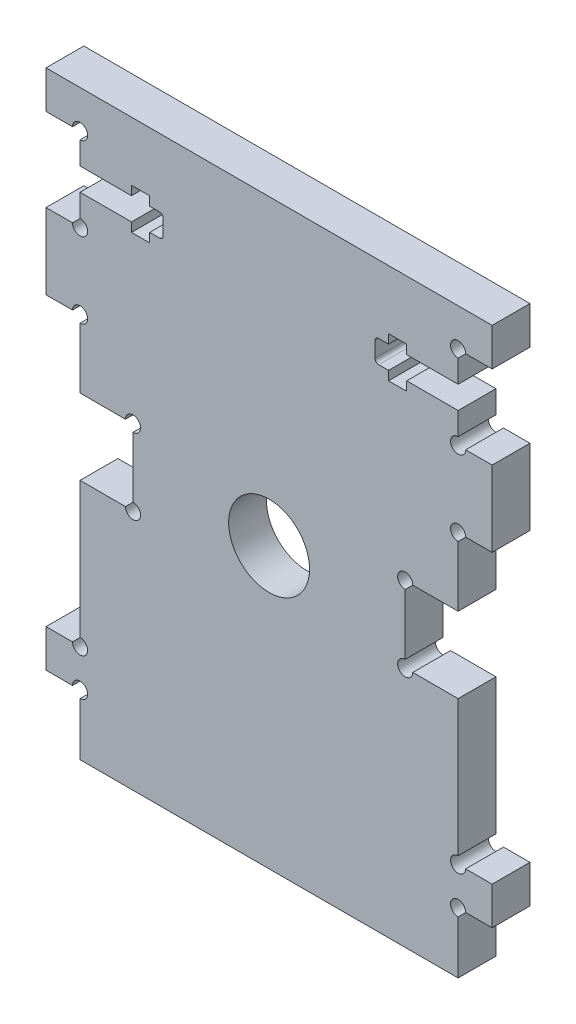
from build123d import *

# Parameters (mm, degrees)
ESBO_O1_R             = 5.35
FLANGE_BASE1_DEPTH    = 5
CORTE_EXTRUS_O1_REACH = 58.115
ESBO_O2_R             = 1
QUEBRA_CANTO1_START   = -5
QUEBRA_CANTO1_DEPTH   = 5


# Read off the part's stored shape, not the designer's step: Quebra-Canto1
# Sheet-metal steps are written as plain solids
with BuildPart() as part:
    # Esboço1 → Flange-base1 (new body)
    with BuildSketch(Plane.XY):
        Polygon((19.699698823, 8.736399513), (12.699698794, 8.736399513), (12.699698794, -1.263600636), (19.699698823, -1.263600636), (19.699698823, -20.26360068), (24.199698913, -20.26360068), (24.199698913, -25.263600799), (19.699698982, -25.263600562), (19.699698823, -28.263600308), (19.699698823, -33.263600919), (-30.300301832, -33.263600919), (-30.300301832, -28.263600308), (-30.30030199, -25.263600562), (-34.800301922, -25.263600799), (-34.800301922, -20.26360068), (-30.300301832, -20.26360068), (-30.300301832, -1.263600636), (-23.300301802, -1.263600636), (-23.300301802, 8.736399513), (-30.300301832, 8.736399513), (-30.300301832, 17.736399558), (-34.800301922, 17.736399558), (-34.800301922, 27.736399558), (-30.300301832, 27.736399558), (-30.300301832, 31.736399692), (-23.500301773, 31.736399692), (-23.500301773, 30.536399744), (-21.100301772, 30.536399744), (-21.100301772, 31.736399692), (-19.300301772, 31.736399692), (-19.300301772, 34.736399796), (-21.100301772, 34.736399796), (-21.100301772, 35.936399744), (-23.500301772, 35.936399744), (-23.500301772, 34.736399796), (-30.300301832, 34.736399796), (-30.300301832, 38.736399796), (-34.800301832, 38.736399796), (-34.800301832, 43.736399796), (24.199698817, 43.736399796), (24.199698817, 38.736399797), (19.699698817, 38.736399797), (19.699698817, 34.736399797), (12.899698227, 34.736399797), (12.899698227, 35.936399744), (10.499698227, 35.936399744), (10.499698227, 34.736399797), (8.699698168, 34.736399797), (8.699698168, 31.736399692), (10.499698227, 31.736399692), (10.499698227, 30.536399751), (12.899698233, 30.536399751), (12.899698233, 31.736399692), (19.699698823, 31.736399692), (19.699698823, 27.736399558), (24.199698913, 27.736399558), (24.199698913, 17.736399558), (19.699698823, 17.736399558), align=None)
        with Locations((-5.300301504, 3.736399439)):
            Circle(ESBO_O1_R, mode=Mode.SUBTRACT)
    extrude(amount=-FLANGE_BASE1_DEPTH)

    # Esboço2 → Corte-extrusão1 (cut, up to next)
    with BuildSketch(Plane.XY, mode=Mode.PRIVATE) as corte_extrus_o1_sk1:
        with Locations((-30.300301832, 38.736399796)):
            Circle(ESBO_O2_R)
    corte_extrus_o1_tool1 = extrude(corte_extrus_o1_sk1.sketch, amount=-CORTE_EXTRUS_O1_REACH, mode=Mode.PRIVATE) & part.part
    # Esboço2 → Corte-extrusão1 (cut, up to next)
    with BuildSketch(Plane.XY, mode=Mode.PRIVATE) as corte_extrus_o1_sk2:
        with Locations((-30.300301832, 27.736399558)):
            Circle(ESBO_O2_R)
    corte_extrus_o1_tool2 = extrude(corte_extrus_o1_sk2.sketch, amount=-CORTE_EXTRUS_O1_REACH, mode=Mode.PRIVATE) & part.part
    # Esboço2 → Corte-extrusão1 (cut, up to next)
    with BuildSketch(Plane.XY, mode=Mode.PRIVATE) as corte_extrus_o1_sk3:
        with Locations((-30.300301832, 17.736399558)):
            Circle(ESBO_O2_R)
    corte_extrus_o1_tool3 = extrude(corte_extrus_o1_sk3.sketch, amount=-CORTE_EXTRUS_O1_REACH, mode=Mode.PRIVATE) & part.part
    # Esboço2 → Corte-extrusão1 (cut, up to next)
    with BuildSketch(Plane.XY, mode=Mode.PRIVATE) as corte_extrus_o1_sk4:
        with Locations((-23.300301802, 8.736399513)):
            Circle(ESBO_O2_R)
    corte_extrus_o1_tool4 = extrude(corte_extrus_o1_sk4.sketch, amount=-CORTE_EXTRUS_O1_REACH, mode=Mode.PRIVATE) & part.part
    # Esboço2 → Corte-extrusão1 (cut, up to next)
    with BuildSketch(Plane.XY, mode=Mode.PRIVATE) as corte_extrus_o1_sk5:
        with Locations((-23.300301802, -1.263600636)):
            Circle(ESBO_O2_R)
    corte_extrus_o1_tool5 = extrude(corte_extrus_o1_sk5.sketch, amount=-CORTE_EXTRUS_O1_REACH, mode=Mode.PRIVATE) & part.part
    # Esboço2 → Corte-extrusão1 (cut, up to next)
    with BuildSketch(Plane.XY, mode=Mode.PRIVATE) as corte_extrus_o1_sk6:
        with Locations((-30.300301832, -20.26360068)):
            Circle(ESBO_O2_R)
    corte_extrus_o1_tool6 = extrude(corte_extrus_o1_sk6.sketch, amount=-CORTE_EXTRUS_O1_REACH, mode=Mode.PRIVATE) & part.part
    # Esboço2 → Corte-extrusão1 (cut, up to next)
    with BuildSketch(Plane.XY, mode=Mode.PRIVATE) as corte_extrus_o1_sk7:
        with Locations((-30.30030199, -25.263600562)):
            Circle(ESBO_O2_R)
    corte_extrus_o1_tool7 = extrude(corte_extrus_o1_sk7.sketch, amount=-CORTE_EXTRUS_O1_REACH, mode=Mode.PRIVATE) & part.part
    # Esboço2 → Corte-extrusão1 (cut, up to next)
    with BuildSketch(Plane.XY, mode=Mode.PRIVATE) as corte_extrus_o1_sk8:
        with Locations((19.699698982, -25.263600562)):
            Circle(ESBO_O2_R)
    corte_extrus_o1_tool8 = extrude(corte_extrus_o1_sk8.sketch, amount=-CORTE_EXTRUS_O1_REACH, mode=Mode.PRIVATE) & part.part
    # Esboço2 → Corte-extrusão1 (cut, up to next)
    with BuildSketch(Plane.XY, mode=Mode.PRIVATE) as corte_extrus_o1_sk9:
        with Locations((19.699698823, -20.26360068)):
            Circle(ESBO_O2_R)
    corte_extrus_o1_tool9 = extrude(corte_extrus_o1_sk9.sketch, amount=-CORTE_EXTRUS_O1_REACH, mode=Mode.PRIVATE) & part.part
    # Esboço2 → Corte-extrusão1 (cut, up to next)
    with BuildSketch(Plane.XY, mode=Mode.PRIVATE) as corte_extrus_o1_sk10:
        with Locations((12.699698794, 8.736399513)):
            Circle(ESBO_O2_R)
    corte_extrus_o1_tool10 = extrude(corte_extrus_o1_sk10.sketch, amount=-CORTE_EXTRUS_O1_REACH, mode=Mode.PRIVATE) & part.part
    # Esboço2 → Corte-extrusão1 (cut, up to next)
    with BuildSketch(Plane.XY, mode=Mode.PRIVATE) as corte_extrus_o1_sk11:
        with Locations((12.699698794, -1.263600636)):
            Circle(ESBO_O2_R)
    corte_extrus_o1_tool11 = extrude(corte_extrus_o1_sk11.sketch, amount=-CORTE_EXTRUS_O1_REACH, mode=Mode.PRIVATE) & part.part
    # Esboço2 → Corte-extrusão1 (cut, up to next)
    with BuildSketch(Plane.XY, mode=Mode.PRIVATE) as corte_extrus_o1_sk12:
        with Locations((19.699698823, 17.736399558)):
            Circle(ESBO_O2_R)
    corte_extrus_o1_tool12 = extrude(corte_extrus_o1_sk12.sketch, amount=-CORTE_EXTRUS_O1_REACH, mode=Mode.PRIVATE) & part.part
    # Esboço2 → Corte-extrusão1 (cut, up to next)
    with BuildSketch(Plane.XY, mode=Mode.PRIVATE) as corte_extrus_o1_sk13:
        with Locations((19.699698817, 38.736399797)):
            Circle(ESBO_O2_R)
    corte_extrus_o1_tool13 = extrude(corte_extrus_o1_sk13.sketch, amount=-CORTE_EXTRUS_O1_REACH, mode=Mode.PRIVATE) & part.part
    # Esboço2 → Corte-extrusão1 (cut, up to next)
    with BuildSketch(Plane.XY, mode=Mode.PRIVATE) as corte_extrus_o1_sk14:
        with Locations((19.699698823, 27.736399558)):
            Circle(ESBO_O2_R)
    corte_extrus_o1_tool14 = extrude(corte_extrus_o1_sk14.sketch, amount=-CORTE_EXTRUS_O1_REACH, mode=Mode.PRIVATE) & part.part
    add(corte_extrus_o1_tool1.solids().sort_by_distance((-30.300302, 38.7364, 0))[0], mode=Mode.SUBTRACT)
    add(corte_extrus_o1_tool2.solids().sort_by_distance((-30.300302, 27.7364, 0))[0], mode=Mode.SUBTRACT)
    add(corte_extrus_o1_tool3.solids().sort_by_distance((-30.300302, 17.7364, 0))[0], mode=Mode.SUBTRACT)
    add(corte_extrus_o1_tool4.solids().sort_by_distance((-23.300302, 8.7364, 0))[0], mode=Mode.SUBTRACT)
    add(corte_extrus_o1_tool5.solids().sort_by_distance((-23.300302, -1.263601, 0))[0], mode=Mode.SUBTRACT)
    add(corte_extrus_o1_tool6.solids().sort_by_distance((-30.300302, -20.263601, 0))[0], mode=Mode.SUBTRACT)
    add(corte_extrus_o1_tool7.solids().sort_by_distance((-30.300302, -25.263601, 0))[0], mode=Mode.SUBTRACT)
    add(corte_extrus_o1_tool8.solids().sort_by_distance((19.699699, -25.263601, 0))[0], mode=Mode.SUBTRACT)
    add(corte_extrus_o1_tool9.solids().sort_by_distance((19.699699, -20.263601, 0))[0], mode=Mode.SUBTRACT)
    add(corte_extrus_o1_tool10.solids().sort_by_distance((12.699699, 8.7364, 0))[0], mode=Mode.SUBTRACT)
    add(corte_extrus_o1_tool11.solids().sort_by_distance((12.699699, -1.263601, 0))[0], mode=Mode.SUBTRACT)
    add(corte_extrus_o1_tool12.solids().sort_by_distance((19.699699, 17.7364, 0))[0], mode=Mode.SUBTRACT)
    add(corte_extrus_o1_tool13.solids().sort_by_distance((19.699699, 38.7364, 0))[0], mode=Mode.SUBTRACT)
    add(corte_extrus_o1_tool14.solids().sort_by_distance((19.699699, 27.7364, 0))[0], mode=Mode.SUBTRACT)

    # Quebra-Canto1 outline → Quebra-Canto1 (add)
    with BuildSketch(Plane.XY.offset(QUEBRA_CANTO1_START)):
        with BuildLine():
            Line((8.699698168, 34.736399797), (8.699698168, 34.236399797))
            ThreePointArc((8.699698168, 34.236399797), (8.846144777, 34.589953188), (9.199698168, 34.736399797))
            Line((9.199698168, 34.736399797), (8.699698168, 34.736399797))
        make_face()
        with BuildLine():
            ThreePointArc((9.199698168, 31.736399692), (8.846144777, 31.882846301), (8.699698168, 32.236399692))
            Line((8.699698168, 32.236399692), (8.699698168, 31.736399692))
            Line((8.699698168, 31.736399692), (9.199698168, 31.736399692))
        make_face()
        with BuildLine():
            Line((-19.300301772, 31.736399692), (-19.300301772, 32.236399692))
            ThreePointArc((-19.300301772, 32.236399692), (-19.446748382, 31.882846301), (-19.800301772, 31.736399692))
            Line((-19.800301772, 31.736399692), (-19.300301772, 31.736399692))
        make_face()
        with BuildLine():
            ThreePointArc((-19.800301772, 34.736399796), (-19.446748382, 34.589953186), (-19.300301772, 34.236399796))
            Line((-19.300301772, 34.236399796), (-19.300301772, 34.736399796))
            Line((-19.300301772, 34.736399796), (-19.800301772, 34.736399796))
        make_face()
    extrude(amount=QUEBRA_CANTO1_DEPTH)


solid = part.part
